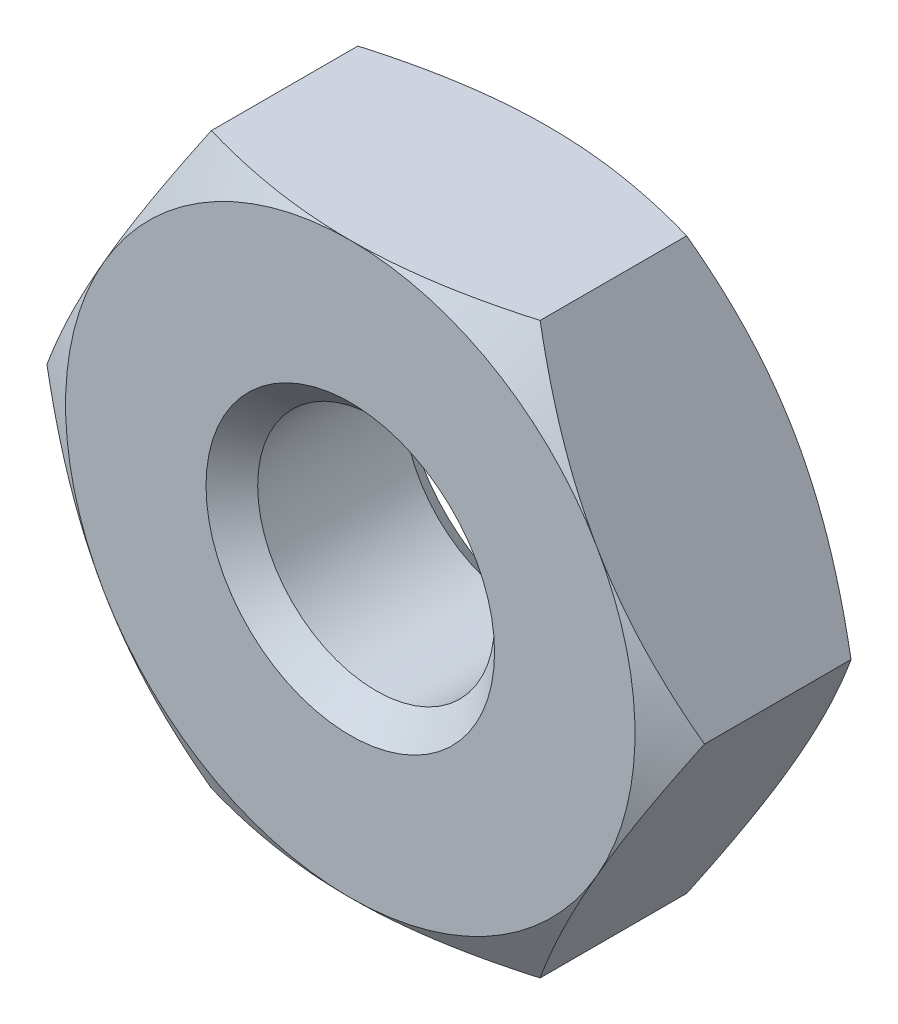
from build123d import *

# Parameters (mm, degrees)
BOSS_EXTRUDE1_DEPTH = 1.651


with BuildPart() as part:
    # Sketch1 → Boss-Extrude1 (new, symmetric)
    with BuildSketch(Plane(origin=(0, 1.651, 0), x_dir=(-1, 0, 0), z_dir=(0, 0, -1))):
        Polygon((2.749630657, 3.1115), (-2.749630657, 3.1115), (-5.499261314, -1.651), (-2.749630657, -6.4135), (2.749630657, -6.4135), (5.499261314, -1.651), align=None)
    extrude(amount=BOSS_EXTRUDE1_DEPTH, both=True)

    # Sketch2 → Cut-Revolve1 (revolve, cut)
    with BuildSketch(Plane(origin=(0, 0, 0), x_dir=(-1, 0, 0), z_dir=(0, 1, 0))):
        Polygon((-5.499261314, -1.225630657), (-5.499261314, -1.651), (-4.7625, -1.651), align=None)
    cut_revolve1 = revolve(axis=Axis((0, 0, 0), (0, 0, -1)), mode=Mode.SUBTRACT)

    # Sketch4 → Cut-Revolve3 (revolve, cut)
    with BuildSketch(Plane(origin=(0, 0, 0), x_dir=(1, 0, 0), z_dir=(0, 1, 0))):
        Polygon((2.413, 1.651), (0, 1.651), (0, -1.2192), (1.9812, -1.2192), (1.9812, 1.2192), align=None)
    cut_revolve3 = revolve(axis=Axis((0, 0, -1.651), (0, 0, 1)), mode=Mode.SUBTRACT)

    # Mirror1: Cut-Revolve1, Cut-Revolve3 across plane
    add(cut_revolve1.mirror(Plane.XY), mode=Mode.SUBTRACT)
    add(cut_revolve3.mirror(Plane.XY), mode=Mode.SUBTRACT)


solid = part.part
